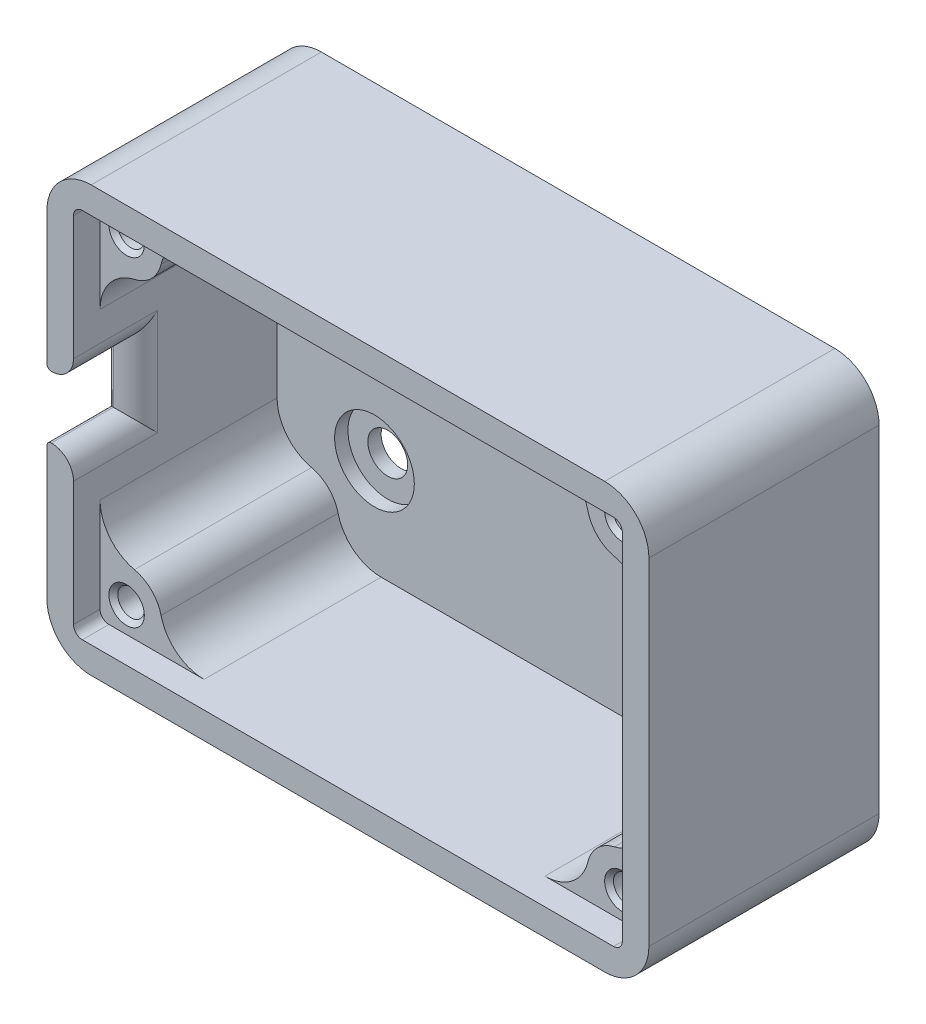
from build123d import *

# Parameters (mm, degrees)
SCHIZZO1_W                   = 68
SCHIZZO1_H                   = 48
SCHIZZO1_R                   = 1.5
SCHIZZO1_R_2                 = 2.25
ESTRUSIONE_ESTRUSIONE1_DEPTH = 3
SCHIZZO2_W                   = 68
SCHIZZO2_H                   = 48
SCHIZZO2_R                   = 1.5
ESTRUSIONE_ESTRUSIONE2_DEPTH = 20
SCHIZZO3_W                   = 68
SCHIZZO3_H                   = 48
SCHIZZO3_W_2                 = 62
SCHIZZO3_H_2                 = 42
ESTRUSIONE_ESTRUSIONE3_DEPTH = 3
SMUSSO1_SIZE                 = 0.5
RACCORDO1_R                  = 5
SCHIZZO4_R                   = 4.5
TAGLIO_ESTRUSIONE1_DEPTH     = 1.5
RACCORDO2_R                  = 5
RACCORDO3_R                  = 1
TAGLIO_ESTRUSIONE2_REACH     = 78.655
SCHIZZO5_W                   = 7
SCHIZZO5_H                   = 7
RACCORDO4_R                  = 2.5
RACCORDO5_R                  = 0.5


with BuildPart() as part:
    # Schizzo1 → Estrusione-Estrusione1 (new body)
    with BuildSketch(Plane.XY):
        Rectangle(SCHIZZO1_W, SCHIZZO1_H)
        with Locations((-28, 18.1)):
            Circle(SCHIZZO1_R, mode=Mode.SUBTRACT)
        with Locations((-28, -18.1)):
            Circle(SCHIZZO1_R, mode=Mode.SUBTRACT)
        with Locations((28, -18.1)):
            Circle(SCHIZZO1_R, mode=Mode.SUBTRACT)
        with Locations((28, 18.1)):
            Circle(SCHIZZO1_R, mode=Mode.SUBTRACT)
        with Locations((20, -10)):
            Circle(SCHIZZO1_R_2, mode=Mode.SUBTRACT)
        with Locations((20, 10)):
            Circle(SCHIZZO1_R_2, mode=Mode.SUBTRACT)
        with Locations((-20, 10)):
            Circle(SCHIZZO1_R_2, mode=Mode.SUBTRACT)
        with Locations((-20, -10)):
            Circle(SCHIZZO1_R_2, mode=Mode.SUBTRACT)
    extrude(amount=ESTRUSIONE_ESTRUSIONE1_DEPTH)

    # Schizzo2 → Estrusione-Estrusione2 (add)
    with BuildSketch(Plane.XY.offset(3)):
        Rectangle(SCHIZZO2_W, SCHIZZO2_H)
        with BuildLine():
            ThreePointArc((-31, 15.454248689), (-25.224419663, 15.219695538), (-25.245004537, 21))
            Line((-25.245004537, 21), (25.245004537, 21))
            ThreePointArc((25.245004537, 21), (25.224419663, 15.219695538), (31, 15.454248689))
            Line((31, 15.454248689), (31, -15.454248689))
            ThreePointArc((31, -15.454248689), (25.224419663, -15.219695538), (25.245004537, -21))
            Line((25.245004537, -21), (-25.245004537, -21))
            ThreePointArc((-25.245004537, -21), (-25.224419663, -15.219695538), (-31, -15.454248689))
            Line((-31, -15.454248689), (-31, 15.454248689))
        make_face(mode=Mode.SUBTRACT)
        with BuildLine():
            ThreePointArc((-30.754995463, 21), (-30.880304462, 20.875580337), (-31, 20.745751311))
            Line((-31, 20.745751311), (-31, 21))
            Line((-31, 21), (-30.754995463, 21))
        make_face(mode=Mode.SUBTRACT)
        with Locations((-28, 18.1)):
            Circle(SCHIZZO2_R, mode=Mode.SUBTRACT)
        with BuildLine():
            Line((-31, -21), (-31, -20.745751311))
            ThreePointArc((-31, -20.745751311), (-30.880304462, -20.875580337), (-30.754995463, -21))
            Line((-30.754995463, -21), (-31, -21))
        make_face(mode=Mode.SUBTRACT)
        with BuildLine():
            Line((31, -21), (30.754995463, -21))
            ThreePointArc((30.754995463, -21), (30.880304462, -20.875580337), (31, -20.745751311))
            Line((31, -20.745751311), (31, -21))
        make_face(mode=Mode.SUBTRACT)
        with BuildLine():
            Line((31, 21), (31, 20.745751311))
            ThreePointArc((31, 20.745751311), (30.880304462, 20.875580337), (30.754995463, 21))
            Line((30.754995463, 21), (31, 21))
        make_face(mode=Mode.SUBTRACT)
        with Locations((-28, -18.1)):
            Circle(SCHIZZO2_R, mode=Mode.SUBTRACT)
        with Locations((28, -18.1)):
            Circle(SCHIZZO2_R, mode=Mode.SUBTRACT)
        with Locations((28, 18.1)):
            Circle(SCHIZZO2_R, mode=Mode.SUBTRACT)
    extrude(amount=ESTRUSIONE_ESTRUSIONE2_DEPTH)

    # Schizzo3 → Estrusione-Estrusione3 (add)
    with BuildSketch(Plane.XY.offset(23)):
        Rectangle(SCHIZZO3_W, SCHIZZO3_H)
        Rectangle(SCHIZZO3_W_2, SCHIZZO3_H_2, mode=Mode.SUBTRACT)
    extrude(amount=ESTRUSIONE_ESTRUSIONE3_DEPTH)

    # Smusso1
    smusso1_edges = [part.edges().sort_by_distance(p)[0] for p in [
        (-29.5, 18.1, 23),
        (26.5, -18.1, 23),
        (-29.5, -18.1, 23),
        (26.5, 18.1, 23),
    ]]
    chamfer(smusso1_edges, length=SMUSSO1_SIZE)

    # Raccordo1
    raccordo1_edges = [part.edges().sort_by_distance(p)[0] for p in [
        (34, 24, 13),
        (34, -24, 13),
        (-34, -24, 13),
        (-34, 24, 13),
    ]]
    fillet(raccordo1_edges, radius=RACCORDO1_R)

    # Schizzo4 → Taglio-Estrusione1 (cut)
    with BuildSketch(Plane.XY.offset(3)):
        with Locations((-20, 10)):
            Circle(SCHIZZO4_R)
        with Locations((-20, -10)):
            Circle(SCHIZZO4_R)
        with Locations((20, -10)):
            Circle(SCHIZZO4_R)
        with Locations((20, 10)):
            Circle(SCHIZZO4_R)
    extrude(amount=-TAGLIO_ESTRUSIONE1_DEPTH, mode=Mode.SUBTRACT)

    # Raccordo2
    raccordo2_edges = [part.edges().sort_by_distance(p)[0] for p in [
        (-31, 15.454248689, 13),
        (-25.245004537, 21, 13),
        (25.245004537, 21, 13),
        (31, 15.454248689, 13),
        (31, -15.454248689, 13),
        (25.245004537, -21, 13),
        (-25.245004537, -21, 13),
        (-31, -15.454248689, 13),
    ]]
    fillet(raccordo2_edges, radius=RACCORDO2_R)

    # Raccordo3
    raccordo3_edges = [part.edges().sort_by_distance(p)[0] for p in [
        (31, -21, 14.5),
        (-31, -21, 14.5),
        (-31, 21, 14.5),
        (31, 21, 14.5),
    ]]
    fillet(raccordo3_edges, radius=RACCORDO3_R)

    # Schizzo5 → Taglio-Estrusione2 (cut, up to next)
    with BuildSketch(Plane.ZY.offset(34), mode=Mode.PRIVATE) as taglio_estrusione2_sk1:
        with Locations((22.5, 0)):
            Rectangle(SCHIZZO5_W, SCHIZZO5_H)
    taglio_estrusione2_tool1 = extrude(taglio_estrusione2_sk1.sketch, amount=-TAGLIO_ESTRUSIONE2_REACH, mode=Mode.PRIVATE) & part.part
    add(taglio_estrusione2_tool1.solids().sort_by_distance((-34, 0, 22.5))[0], mode=Mode.SUBTRACT)

    # Raccordo4
    raccordo4_edges = [part.edges().sort_by_distance(p)[0] for p in [
        (-31, -3.5, 22.5),
        (-31, 0, 19),
        (-31, 3.5, 22.5),
    ]]
    fillet(raccordo4_edges, radius=RACCORDO4_R)

    # Raccordo5
    raccordo5_edges = [part.edges().sort_by_distance(p)[0] for p in [
        (-34, -3.5, 22.5),
        (-34, 0, 19),
        (-34, 3.5, 22.5),
    ]]
    fillet(raccordo5_edges, radius=RACCORDO5_R - 0.0001)  # a hair under: the kernel refuses the full size


solid = part.part
